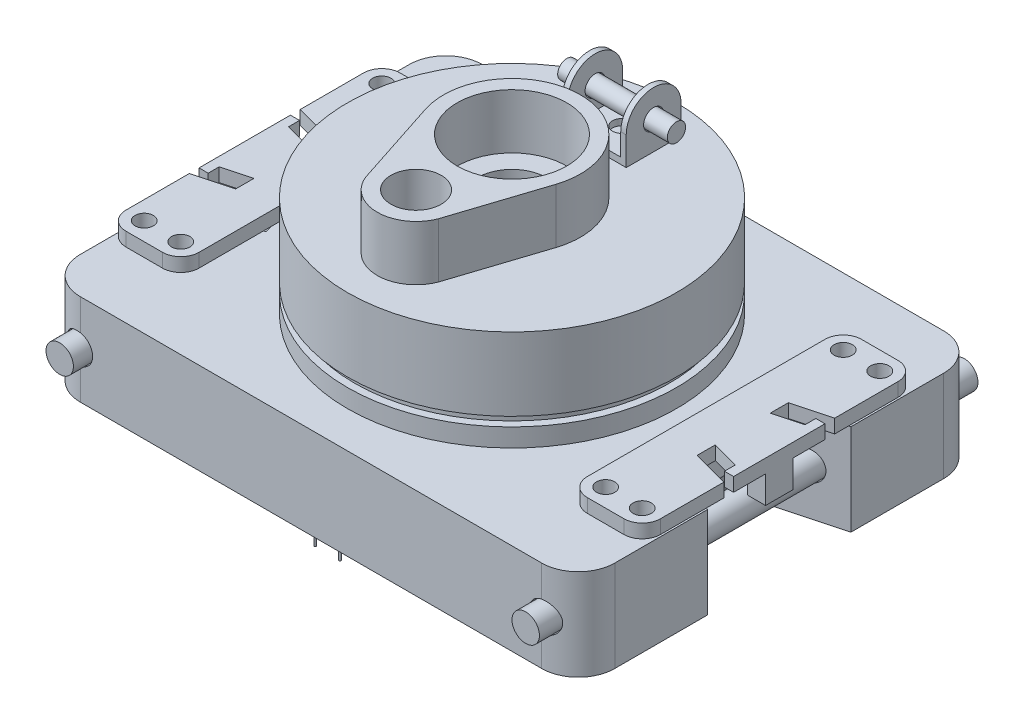
from build123d import *

# Parameters (mm, degrees)
CROQUIS1_R                     = 90
SALIENTE_EXTRUIR1_DEPTH        = 50
CROQUIS2_R                     = 30
CROQUIS2_R_2                   = 13.75
SALIENTE_EXTRUIR2_DEPTH        = 30
VACIADO1_START                 = -50
VACIADO1_OUTLINE_R             = 80
VACIADO1_DEPTH                 = 40
CORTAR_EXTRUIR1_REACH          = 138.748
CROQUIS2_3_R                   = 19
CROQUIS2_3_R_2                 = 9
CROQUIS4_R                     = 23
CROQUIS4_R_2                   = 19
SALIENTE_EXTRUIR3_DEPTH        = 95
SALIENTE_EXTRUIR4_DEPTH        = 50
CORTAR_EXTRUIR2_START          = -10
CROQUIS6_R                     = 90
CROQUIS6_R_2                   = 85
CORTAR_EXTRUIR2_DEPTH          = 10
SALIENTE_EXTRUIR6_START        = 10
CROQUIS5_3_R                   = 90
SALIENTE_EXTRUIR6_DEPTH        = 10
CORTAR_EXTRUIR4_DEPTH          = 10
CORTAR_EXTRUIR4_DEPTH_BACK     = 20
CROQUIS5_4_R                   = 86
CORTAR_EXTRUIR6_DEPTH          = 211.984835863
CORTAR_EXTRUIR6_DEPTH_BACK     = 211.984835863
CROQUIS7_R                     = 8
CROQUIS7_R_2                   = 7.5
SALIENTE_EXTRUIR7_DEPTH        = 120
SALIENTE_EXTRUIR7_DEPTH_BACK   = 120
CROQUIS7_6_R                   = 7.5
SALIENTE_EXTRUIR7_2_DEPTH      = 120
SALIENTE_EXTRUIR7_2_DEPTH_BACK = 120
CROQUIS10_R                    = 40
CROQUIS10_R_2                  = 25
SALIENTE_EXTRUIR8_DEPTH        = 15
CROQUIS11_R                    = 2.5
CROQUIS11_R_2                  = 23.75
SALIENTE_EXTRUIR9_DEPTH        = 5
CROQUIS11_R_3                  = 5
SALIENTE_EXTRUIR9_2_DEPTH      = 5
CROQUIS12_R                    = 25
CORTAR_EXTRUIR7_DEPTH          = 217.366820454
CROQUIS13_R                    = 35
CORTAR_EXTRUIR8_DEPTH          = 10
CROQUIS14_R                    = 5
SALIENTE_EXTRUIR10_DEPTH       = 7.5
SALIENTE_EXTRUIR10_2_DEPTH     = 7.5
CROQUIS15_W                    = 35
CROQUIS15_H                    = 30
CROQUIS15_R                    = 5
SALIENTE_EXTRUIR11_DEPTH       = 35
CORTAR_EXTRUIR9_START          = -30
CROQUIS16_W                    = 29
CROQUIS16_H                    = 31
CORTAR_EXTRUIR9_DEPTH          = 30
SALIENTE_EXTRUIR12_DEPTH       = 30
SALIENTE_EXTRUIR12_DEPTH_BACK  = 30
CROQUIS17_R                    = 5
CORTAR_EXTRUIR13_DEPTH         = 217.366820503
CORTAR_EXTRUIR13_DEPTH_BACK    = 217.366820503
CROQUIS17_4_R                  = 5.5
CROQUIS17_4_R_2                = 5
CROQUIS17_4_W                  = 30
CROQUIS17_4_H                  = 0.5
CROQUIS4_3_R                   = 35
CROQUIS4_3_R_2                 = 2.5
CROQUIS4_3_R_3                 = 23
SALIENTE_EXTRUIR13_DEPTH       = 7.5
CROQUIS18_R                    = 0.5
SALIENTE_EXTRUIR15_DEPTH       = 13
CROQUIS18_5_R                  = 25
SALIENTE_EXTRUIR16_DEPTH       = 5
CROQUIS19_W                    = 240
CROQUIS19_H                    = 240
CORTAR_EXTRUIR10_DEPTH         = 1
CHAFL_N1_SIZE                  = 10
CHAFL_N1_SIZE2                 = 25
CHAFL_N2_SIZE                  = 25
CHAFL_N2_SIZE2                 = 10
CROQUIS20_R                    = 35
CORTAR_EXTRUIR12_DEPTH         = 1
CROQUIS21_W                    = 10
CROQUIS21_H                    = 15
SALIENTE_EXTRUIR17_DEPTH       = 15


with BuildPart() as part:
    # Croquis1 → Saliente-Extruir1 (new body)
    with BuildSketch(Plane(origin=(0, 0, 0), x_dir=(1, 0, 0), z_dir=(0, 1, 0))):
        with Locations(Location((0, 0, 0), (0, 0, 270))):
            Circle(CROQUIS1_R)
    extrude(amount=-SALIENTE_EXTRUIR1_DEPTH)

    # Croquis2 → Saliente-Extruir2 (add)
    with BuildSketch(Plane(origin=(0, 0, 0), x_dir=(1, 0, 0), z_dir=(0, 1, 0))):
        with BuildLine():
            Line((19.816696997, -60.172093596), (35.651210757, -11.629323779))
            ThreePointArc((35.651210757, -11.629323779), (0, 37.5), (-35.651210757, -11.629323779))
            Line((-35.651210757, -11.629323779), (-19.816696997, -60.172093596))
            ThreePointArc((-19.816696997, -60.172093596), (0, -73.75), (19.816696997, -60.172093596))
        make_face()
        with Locations(Location((0, 0, 0), (0, 0, 270))):
            Circle(CROQUIS2_R, mode=Mode.SUBTRACT)
        with Locations(Location((0, -52.5, 0), (0, 0, 270))):
            Circle(CROQUIS2_R_2, mode=Mode.SUBTRACT)
    extrude(amount=SALIENTE_EXTRUIR2_DEPTH)

    # Vaciado1: read off the stored shape, not the designer's step
    # Vaciado1 outline → Vaciado1 (cut)
    with BuildSketch(Plane(origin=(0, 0, 0), x_dir=(1, 0, 0), z_dir=(0, 1, 0)).offset(VACIADO1_START)):
        Circle(VACIADO1_OUTLINE_R)
    extrude(amount=VACIADO1_DEPTH, mode=Mode.SUBTRACT)

    # Croquis2<3> → Cortar-Extruir1 (cut, up to next)
    with BuildSketch(Plane(origin=(0, 0, 0), x_dir=(1, 0, 0), z_dir=(0, 1, 0)), mode=Mode.PRIVATE) as cortar_extruir1_sk1:
        with Locations(Location((0, 0, 0), (0, 0, 270))):
            Circle(CROQUIS2_3_R)
    cortar_extruir1_tool1 = extrude(cortar_extruir1_sk1.sketch, amount=-CORTAR_EXTRUIR1_REACH, mode=Mode.PRIVATE) & part.part
    # Croquis2<3> → Cortar-Extruir1 (cut, up to next)
    with BuildSketch(Plane(origin=(0, 0, 0), x_dir=(1, 0, 0), z_dir=(0, 1, 0)), mode=Mode.PRIVATE) as cortar_extruir1_sk2:
        with Locations(Location((0, -52.5, 0), (0, 0, 270))):
            Circle(CROQUIS2_3_R_2)
    cortar_extruir1_tool2 = extrude(cortar_extruir1_sk2.sketch, amount=-CORTAR_EXTRUIR1_REACH, mode=Mode.PRIVATE) & part.part
    add(cortar_extruir1_tool1.solids().sort_by_distance((0, 0, 0))[0], mode=Mode.SUBTRACT)
    add(cortar_extruir1_tool2.solids().sort_by_distance((0, 0, 52.5))[0], mode=Mode.SUBTRACT)

    # Croquis4 → Saliente-Extruir3 (add)
    with BuildSketch(Plane.XZ.offset(10)):
        with Locations(Location((0, 0, 0), (0, 0, 90))):
            Circle(CROQUIS4_R)
        with Locations(Location((0, 0, 0), (0, 0, 90))):
            Circle(CROQUIS4_R_2, mode=Mode.SUBTRACT)
    extrude(amount=SALIENTE_EXTRUIR3_DEPTH)

    # Croquis6 → Cortar-Extruir2 (cut)
    with BuildSketch(Plane.XZ.offset(50).offset(CORTAR_EXTRUIR2_START)):
        with Locations(Location((0, 0, 0), (0, 0, 90))):
            Circle(CROQUIS6_R)
        with Locations(Location((0, 0, 0), (0, 0, 270))):
            Circle(CROQUIS6_R_2, mode=Mode.SUBTRACT)
    extrude(amount=CORTAR_EXTRUIR2_DEPTH, mode=Mode.SUBTRACT)

    # Croquis15 → Saliente-Extruir11 (add)
    with BuildSketch(Plane(origin=(0, 0, 0), x_dir=(1, 0, 0), z_dir=(0, 1, 0))):
        with Locations((0, 60)):
            Rectangle(CROQUIS15_W, CROQUIS15_H)
        with Locations(Location((0, 60, 0), (0, 0, 270))):
            Circle(CROQUIS15_R, mode=Mode.SUBTRACT)
    extrude(amount=SALIENTE_EXTRUIR11_DEPTH)

    # Croquis16 → Cortar-Extruir9 (cut)
    with BuildSketch(Plane(origin=(0, 0, -75), x_dir=(-1, 0, 0), z_dir=(0, 0, -1)).offset(CORTAR_EXTRUIR9_START)):
        with Locations((0, 19.5)):
            Rectangle(CROQUIS16_W, CROQUIS16_H)
    extrude(amount=CORTAR_EXTRUIR9_DEPTH, mode=Mode.SUBTRACT)

    # Croquis17 → Saliente-Extruir12 (add, two sides: drawn at the far end of the back side and taken through both)
    with BuildSketch(Plane(origin=(0, 0, 0), x_dir=(0, 0, -1), z_dir=(1, 0, 0)).offset(-SALIENTE_EXTRUIR12_DEPTH_BACK)):
        with Locations(Location((60, 16, 0), (0, 0, 90))):
            Circle(CROQUIS17_R)
    extrude(amount=SALIENTE_EXTRUIR12_DEPTH + SALIENTE_EXTRUIR12_DEPTH_BACK)

    # Croquis17<4> → Cortar-Extruir13 (cut, two sides: drawn at the far end of the back side and taken through both)
    # profile 1 of 3: a face of its own
    with BuildSketch(Plane(origin=(0, 0, 0), x_dir=(0, 0, -1), z_dir=(1, 0, 0)).offset(-CORTAR_EXTRUIR13_DEPTH_BACK)):
        with Locations((60, 16)):
            Circle(CROQUIS17_4_R)
        with Locations((60, 16)):
            Circle(CROQUIS17_4_R_2, mode=Mode.SUBTRACT)
    # profile 2 of 3: a face of its own
    with BuildSketch(Plane(origin=(0, 0, 0), x_dir=(0, 0, -1), z_dir=(1, 0, 0)).offset(-CORTAR_EXTRUIR13_DEPTH_BACK)):
        with BuildLine():
            Line((45, 36), (75, 36))
            Line((75, 36), (75, 16))
            ThreePointArc((75, 16), (60, 31), (45, 16))
            Line((45, 16), (45, 36))
        make_face()
    # profile 3 of 3: a face of its own
    with BuildSketch(Plane(origin=(0, 0, 0), x_dir=(0, 0, -1), z_dir=(1, 0, 0)).offset(-CORTAR_EXTRUIR13_DEPTH_BACK)):
        with Locations((60, 0.25)):
            Rectangle(CROQUIS17_4_W, CROQUIS17_4_H)
    extrude(amount=CORTAR_EXTRUIR13_DEPTH + CORTAR_EXTRUIR13_DEPTH_BACK, mode=Mode.SUBTRACT)


with BuildPart() as body_2:
    # Croquis5 → Saliente-Extruir4 (new body)
    with BuildSketch(Plane(origin=(0, -55, 0), x_dir=(1, 0, 0), z_dir=(0, 1, 0))):
        with BuildLine():
            Line((106.251840892, 28.470094961), (146.251840892, 39.188062659))
            Line((146.251840892, 39.188062659), (146.251840892, 90))
            ThreePointArc((146.251840892, 90), (140.393976516, 104.142135624), (126.251840892, 110))
            Line((126.251840892, 110), (-126.251840892, 110))
            ThreePointArc((-126.251840892, 110), (-140.393976516, 104.142135624), (-146.251840892, 90))
            Line((-146.251840892, 90), (-146.251840892, 39.188062659))
            Line((-146.251840892, 39.188062659), (-106.251840892, 28.470094961))
            ThreePointArc((-106.251840892, 28.470094961), (-110, 0), (-106.251840892, -28.470094961))
            Line((-106.251840892, -28.470094961), (-146.251840892, -39.188062659))
            Line((-146.251840892, -39.188062659), (-146.251840892, -90))
            ThreePointArc((-146.251840892, -90), (-140.393976516, -104.142135624), (-126.251840892, -110))
            Line((-126.251840892, -110), (126.251840892, -110))
            ThreePointArc((126.251840892, -110), (140.393976516, -104.142135624), (146.251840892, -90))
            Line((146.251840892, -90), (146.251840892, -39.188062659))
            Line((146.251840892, -39.188062659), (106.251840892, -28.470094961))
            ThreePointArc((106.251840892, -28.470094961), (110, 0), (106.251840892, 28.470094961))
        make_face()
    extrude(amount=-SALIENTE_EXTRUIR4_DEPTH)

    # Croquis5<3> → Saliente-Extruir6 (add)
    with BuildSketch(Plane(origin=(0, -55, 0), x_dir=(1, 0, 0), z_dir=(0, 1, 0)).offset(SALIENTE_EXTRUIR6_START)):
        with Locations(Location((0, 0, 0), (0, 0, 270))):
            Circle(CROQUIS5_3_R)
    extrude(amount=-SALIENTE_EXTRUIR6_DEPTH)

    # Croquis5<4> → Cortar-Extruir4 (cut, two sides: drawn at the far end of the back side and taken through both)
    with BuildSketch(Plane(origin=(0, -55, 0), x_dir=(1, 0, 0), z_dir=(0, 1, 0)).offset(-CORTAR_EXTRUIR4_DEPTH_BACK)):
        with Locations(Location((0, 0, 0), (0, 0, 270))):
            Circle(CROQUIS5_4_R)
    extrude(amount=CORTAR_EXTRUIR4_DEPTH + CORTAR_EXTRUIR4_DEPTH_BACK, mode=Mode.SUBTRACT)

    # Croquis7 → Cortar-Extruir6 (cut, two sides: drawn at the far end of the back side and taken through both)
    # profile 1 of 2: a face of its own
    with BuildSketch(Plane.XY.offset(-CORTAR_EXTRUIR6_DEPTH_BACK)):
        with Locations((127.5, -80)):
            Circle(CROQUIS7_R)
        with Locations((127.5, -80)):
            Circle(CROQUIS7_R_2, mode=Mode.SUBTRACT)
    # profile 2 of 2: a face of its own
    with BuildSketch(Plane.XY.offset(-CORTAR_EXTRUIR6_DEPTH_BACK)):
        with Locations(Location((-127.5, -80, 0), (0, 0, 81.024048776))):
            Circle(CROQUIS7_R)
        with Locations((-127.5, -80)):
            Circle(CROQUIS7_R_2, mode=Mode.SUBTRACT)
    extrude(amount=CORTAR_EXTRUIR6_DEPTH + CORTAR_EXTRUIR6_DEPTH_BACK, mode=Mode.SUBTRACT)


with BuildPart() as cortar_extruir6_kept_piece:
    # of the separate pieces the step leaves, the one the design keeps (cortar_extruir6_pieces_kept)
    add(body_2.part.solids().sort_by_distance((106.251840892, -55, -28.470094961))[0])

    # Croquis10 → Saliente-Extruir8 (add)
    with BuildSketch(Plane(origin=(0, -75, 0), x_dir=(1, 0, 0), z_dir=(0, 1, 0))):
        with Locations(Location((0, 0, 0), (0, 0, 270))):
            Circle(CROQUIS10_R)
        with Locations(Location((0, 0, 0), (0, 0, 270))):
            Circle(CROQUIS10_R_2, mode=Mode.SUBTRACT)
    extrude(amount=SALIENTE_EXTRUIR8_DEPTH)

    # Croquis12 → Cortar-Extruir7 (cut, through all)
    with BuildSketch(Plane(origin=(0, -75, 0), x_dir=(1, 0, 0), z_dir=(0, 1, 0))):
        with Locations(Location((0, 0, 0), (0, 0, 270))):
            Circle(CROQUIS12_R)
    extrude(amount=-CORTAR_EXTRUIR7_DEPTH, mode=Mode.SUBTRACT)

    # Croquis13 → Cortar-Extruir8 (cut)
    with BuildSketch(Plane.XZ.offset(105)):
        with Locations(Location((0, 0, 0), (0, 0, 270))):
            Circle(CROQUIS13_R)
    extrude(amount=-CORTAR_EXTRUIR8_DEPTH, mode=Mode.SUBTRACT)

    # Croquis18 → Saliente-Extruir15 (add)
    with BuildSketch(Plane.XZ.offset(105)):
        with Locations(Location((-77.166430053, -6.465637775, 0), (0, 0, 270))):
            Circle(CROQUIS18_R)
        with Locations(Location((-81.616023522, -9.698456663, 0), (0, 0, 270))):
            Circle(CROQUIS18_R)
        with Locations(Location((-86.065616991, -12.93127555, 0), (0, 0, 270))):
            Circle(CROQUIS18_R)
        with Locations(Location((-63.817649646, 3.232818888, 0), (0, 0, 270))):
            Circle(CROQUIS18_R)
        with Locations(Location((-59.368056177, 6.465637775, 0), (0, 0, 270))):
            Circle(CROQUIS18_R)
        with Locations(Location((-54.918462708, 9.698456663, 0), (0, 0, 270))):
            Circle(CROQUIS18_R)
        with Locations(Location((-50.468869239, 12.93127555, 0), (0, 0, 270))):
            Circle(CROQUIS18_R)
        with Locations(Location((-66.567649646, 5.23081084, 0), (0, 0, 270))):
            Circle(CROQUIS18_R)
        with Locations(Location((-64.868056177, 10.461621679, 0), (0, 0, 270))):
            Circle(CROQUIS18_R)
        with Locations(Location((-63.168462708, 15.692432519, 0), (0, 0, 270))):
            Circle(CROQUIS18_R)
        with Locations(Location((-61.468869239, 20.923243358, 0), (0, 0, 270))):
            Circle(CROQUIS18_R)
        with Locations(Location((-75.065616991, 20.923243358, 0), (0, 0, 270))):
            Circle(CROQUIS18_R)
        with Locations(Location((-73.366023522, 15.692432519, 0), (0, 0, 270))):
            Circle(CROQUIS18_R)
        with Locations(Location((-71.666430053, 10.461621679, 0), (0, 0, 270))):
            Circle(CROQUIS18_R)
        with Locations(Location((-69.966836584, 5.23081084, 0), (0, 0, 270))):
            Circle(CROQUIS18_R)
        with Locations(Location((-72.716836584, 3.232818888, 0), (0, 0, 270))):
            Circle(CROQUIS18_R)
        with Locations(Location((22, 80, 0), (0, 0, 270))):
            Circle(CROQUIS18_R)
        with Locations(Location((16.5, 80, 0), (0, 0, 270))):
            Circle(CROQUIS18_R)
        with Locations(Location((5.5, 80, 0), (0, 0, 270))):
            Circle(CROQUIS18_R)
        with Locations(Location((11, 80, 0), (0, 0, 270))):
            Circle(CROQUIS18_R)
        with Locations(Location((17.798373876, 67.06872445, 0), (0, 0, 270))):
            Circle(CROQUIS18_R)
        with Locations(Location((13.348780407, 70.301543337, 0), (0, 0, 270))):
            Circle(CROQUIS18_R)
        with Locations(Location((8.899186938, 73.534362225, 0), (0, 0, 270))):
            Circle(CROQUIS18_R)
        with Locations(Location((4.449593469, 76.767181112, 0), (0, 0, 270))):
            Circle(CROQUIS18_R)
        with Locations(Location((0, 80, 0), (0, 0, 270))):
            Circle(CROQUIS18_R)
        with Locations(Location((4.449593469, 83.232818888, 0), (0, 0, 270))):
            Circle(CROQUIS18_R)
        with Locations(Location((8.899186938, 86.465637775, 0), (0, 0, 270))):
            Circle(CROQUIS18_R)
        with Locations(Location((13.348780407, 89.698456663, 0), (0, 0, 270))):
            Circle(CROQUIS18_R)
        with Locations(Location((17.798373876, 92.93127555, 0), (0, 0, 270))):
            Circle(CROQUIS18_R)
        with Locations(Location((3.399186938, 90.461621679, 0), (0, 0, 270))):
            Circle(CROQUIS18_R)
        with Locations(Location((5.098780407, 95.692432519, 0), (0, 0, 270))):
            Circle(CROQUIS18_R)
        with Locations(Location((6.798373876, 100.923243358, 0), (0, 0, 270))):
            Circle(CROQUIS18_R)
        with Locations(Location((-6.798373876, 100.923243358, 0), (0, 0, 270))):
            Circle(CROQUIS18_R)
        with Locations(Location((-5.098780407, 95.692432519, 0), (0, 0, 270))):
            Circle(CROQUIS18_R)
        with Locations(Location((-3.399186938, 90.461621679, 0), (0, 0, 270))):
            Circle(CROQUIS18_R)
        with Locations(Location((1.699593469, 85.23081084, 0), (0, 0, 270))):
            Circle(CROQUIS18_R)
        with Locations(Location((-1.699593469, 85.23081084, 0), (0, 0, 270))):
            Circle(CROQUIS18_R)
        with Locations(Location((-4.449593469, 83.232818888, 0), (0, 0, 270))):
            Circle(CROQUIS18_R)
        with Locations(Location((-8.899186938, 86.465637775, 0), (0, 0, 270))):
            Circle(CROQUIS18_R)
        with Locations(Location((-13.348780407, 89.698456663, 0), (0, 0, 270))):
            Circle(CROQUIS18_R)
        with Locations(Location((-17.798373876, 92.93127555, 0), (0, 0, 270))):
            Circle(CROQUIS18_R)
        with Locations(Location((-22, 80, 0), (0, 0, 270))):
            Circle(CROQUIS18_R)
        with Locations(Location((-16.5, 80, 0), (0, 0, 270))):
            Circle(CROQUIS18_R)
        with Locations(Location((-17.798373876, 67.06872445, 0), (0, 0, 270))):
            Circle(CROQUIS18_R)
        with Locations(Location((-13.348780407, 70.301543337, 0), (0, 0, 270))):
            Circle(CROQUIS18_R)
        with Locations(Location((-11, 80, 0), (0, 0, 270))):
            Circle(CROQUIS18_R)
        with Locations(Location((-8.899186938, 73.534362225, 0), (0, 0, 270))):
            Circle(CROQUIS18_R)
        with Locations(Location((-4.449593469, 76.767181112, 0), (0, 0, 270))):
            Circle(CROQUIS18_R)
        with Locations(Location((-5.5, 80, 0), (0, 0, 270))):
            Circle(CROQUIS18_R)
        with Locations(Location((-3.399186938, 69.538378321, 0), (0, 0, 270))):
            Circle(CROQUIS18_R)
        with Locations(Location((-5.098780407, 64.307567481, 0), (0, 0, 270))):
            Circle(CROQUIS18_R)
        with Locations(Location((-6.798373876, 59.076756642, 0), (0, 0, 270))):
            Circle(CROQUIS18_R)
        with Locations(Location((6.798373876, 59.076756642, 0), (0, 0, 270))):
            Circle(CROQUIS18_R)
        with Locations(Location((5.098780407, 64.307567481, 0), (0, 0, 270))):
            Circle(CROQUIS18_R)
        with Locations(Location((3.399186938, 69.538378321, 0), (0, 0, 270))):
            Circle(CROQUIS18_R)
        with Locations(Location((1.699593469, 74.76918916, 0), (0, 0, 270))):
            Circle(CROQUIS18_R)
        with Locations(Location((-1.699593469, 74.76918916, 0), (0, 0, 270))):
            Circle(CROQUIS18_R)
        with Locations(Location((75.065616991, -20.923243358, 0), (0, 0, 270))):
            Circle(CROQUIS18_R)
        with Locations(Location((73.366023522, -15.692432519, 0), (0, 0, 270))):
            Circle(CROQUIS18_R)
        with Locations(Location((71.666430053, -10.461621679, 0), (0, 0, 270))):
            Circle(CROQUIS18_R)
        with Locations(Location((69.966836584, -5.23081084, 0), (0, 0, 270))):
            Circle(CROQUIS18_R)
        with Locations(Location((68.267243115, 0, 0), (0, 0, 270))):
            Circle(CROQUIS18_R)
        with Locations(Location((66.567649646, 5.23081084, 0), (0, 0, 270))):
            Circle(CROQUIS18_R)
        with Locations(Location((64.868056177, 10.461621679, 0), (0, 0, 270))):
            Circle(CROQUIS18_R)
        with Locations(Location((63.168462708, 15.692432519, 0), (0, 0, 270))):
            Circle(CROQUIS18_R)
        with Locations(Location((61.468869239, 20.923243358, 0), (0, 0, 270))):
            Circle(CROQUIS18_R)
        with Locations(Location((75.065616991, 20.923243358, 0), (0, 0, 270))):
            Circle(CROQUIS18_R)
        with Locations(Location((73.366023522, 15.692432519, 0), (0, 0, 270))):
            Circle(CROQUIS18_R)
        with Locations(Location((71.666430053, 10.461621679, 0), (0, 0, 270))):
            Circle(CROQUIS18_R)
        with Locations(Location((69.966836584, 5.23081084, 0), (0, 0, 270))):
            Circle(CROQUIS18_R)
        with Locations(Location((66.567649646, -5.23081084, 0), (0, 0, 270))):
            Circle(CROQUIS18_R)
        with Locations(Location((64.868056177, -10.461621679, 0), (0, 0, 270))):
            Circle(CROQUIS18_R)
        with Locations(Location((63.168462708, -15.692432519, 0), (0, 0, 270))):
            Circle(CROQUIS18_R)
        with Locations(Location((61.468869239, -20.923243358, 0), (0, 0, 270))):
            Circle(CROQUIS18_R)
        with Locations(Location((50.468869239, 12.93127555, 0), (0, 0, 270))):
            Circle(CROQUIS18_R)
        with Locations(Location((54.918462708, 9.698456663, 0), (0, 0, 270))):
            Circle(CROQUIS18_R)
        with Locations(Location((59.368056177, 6.465637775, 0), (0, 0, 270))):
            Circle(CROQUIS18_R)
        with Locations(Location((63.817649646, 3.232818888, 0), (0, 0, 270))):
            Circle(CROQUIS18_R)
        with Locations(Location((72.716836584, -3.232818888, 0), (0, 0, 270))):
            Circle(CROQUIS18_R)
        with Locations(Location((77.166430053, -6.465637775, 0), (0, 0, 270))):
            Circle(CROQUIS18_R)
        with Locations(Location((81.616023522, -9.698456663, 0), (0, 0, 270))):
            Circle(CROQUIS18_R)
        with Locations(Location((86.065616991, -12.93127555, 0), (0, 0, 270))):
            Circle(CROQUIS18_R)
        with Locations(Location((50.468869239, -12.93127555, 0), (0, 0, 270))):
            Circle(CROQUIS18_R)
        with Locations(Location((54.918462708, -9.698456663, 0), (0, 0, 270))):
            Circle(CROQUIS18_R)
        with Locations(Location((59.368056177, -6.465637775, 0), (0, 0, 270))):
            Circle(CROQUIS18_R)
        with Locations(Location((63.817649646, -3.232818888, 0), (0, 0, 270))):
            Circle(CROQUIS18_R)
        with Locations(Location((72.716836584, 3.232818888, 0), (0, 0, 270))):
            Circle(CROQUIS18_R)
        with Locations(Location((77.166430053, 6.465637775, 0), (0, 0, 270))):
            Circle(CROQUIS18_R)
        with Locations(Location((81.616023522, 9.698456663, 0), (0, 0, 270))):
            Circle(CROQUIS18_R)
        with Locations(Location((86.065616991, 12.93127555, 0), (0, 0, 270))):
            Circle(CROQUIS18_R)
        with Locations(Location((90.267243115, 0, 0), (0, 0, 270))):
            Circle(CROQUIS18_R)
        with Locations(Location((84.767243115, 0, 0), (0, 0, 270))):
            Circle(CROQUIS18_R)
        with Locations(Location((79.267243115, 0, 0), (0, 0, 270))):
            Circle(CROQUIS18_R)
        with Locations(Location((73.767243115, 0, 0), (0, 0, 270))):
            Circle(CROQUIS18_R)
        with Locations(Location((62.767243115, 0, 0), (0, 0, 270))):
            Circle(CROQUIS18_R)
        with Locations(Location((57.267243115, 0, 0), (0, 0, 270))):
            Circle(CROQUIS18_R)
        with Locations(Location((51.767243115, 0, 0), (0, 0, 270))):
            Circle(CROQUIS18_R)
        with Locations(Location((46.267243115, 0, 0), (0, 0, 270))):
            Circle(CROQUIS18_R)
        with Locations(Location((-46.267243115, 0, 0), (0, 0, 90))):
            Circle(CROQUIS18_R)
        with Locations(Location((-51.767243115, 0, 0), (0, 0, 90))):
            Circle(CROQUIS18_R)
        with Locations(Location((-57.267243115, 0, 0), (0, 0, 90))):
            Circle(CROQUIS18_R)
        with Locations(Location((-62.767243115, 0, 0), (0, 0, 90))):
            Circle(CROQUIS18_R)
        with Locations(Location((-68.267243115, 0, 0), (0, 0, 90))):
            Circle(CROQUIS18_R)
        with Locations(Location((-73.767243115, 0, 0), (0, 0, 90))):
            Circle(CROQUIS18_R)
        with Locations(Location((-79.267243115, 0, 0), (0, 0, 90))):
            Circle(CROQUIS18_R)
        with Locations(Location((-84.767243115, 0, 0), (0, 0, 90))):
            Circle(CROQUIS18_R)
        with Locations(Location((-90.267243115, 0, 0), (0, 0, 90))):
            Circle(CROQUIS18_R)
        with Locations(Location((-72.716836584, -3.232818888, 0), (0, 0, 90))):
            Circle(CROQUIS18_R)
        with Locations(Location((-77.166430053, 6.465637775, 0), (0, 0, 90))):
            Circle(CROQUIS18_R)
        with Locations(Location((-81.616023522, 9.698456663, 0), (0, 0, 90))):
            Circle(CROQUIS18_R)
        with Locations(Location((-86.065616991, 12.93127555, 0), (0, 0, 90))):
            Circle(CROQUIS18_R)
        with Locations(Location((-69.966836584, -5.23081084, 0), (0, 0, 90))):
            Circle(CROQUIS18_R)
        with Locations(Location((-66.567649646, -5.23081084, 0), (0, 0, 90))):
            Circle(CROQUIS18_R)
        with Locations(Location((-63.817649646, -3.232818888, 0), (0, 0, 90))):
            Circle(CROQUIS18_R)
        with Locations(Location((-61.468869239, -20.923243358, 0), (0, 0, 90))):
            Circle(CROQUIS18_R)
        with Locations(Location((-63.168462708, -15.692432519, 0), (0, 0, 90))):
            Circle(CROQUIS18_R)
        with Locations(Location((-64.868056177, -10.461621679, 0), (0, 0, 90))):
            Circle(CROQUIS18_R)
        with Locations(Location((-71.666430053, -10.461621679, 0), (0, 0, 90))):
            Circle(CROQUIS18_R)
        with Locations(Location((-73.366023522, -15.692432519, 0), (0, 0, 90))):
            Circle(CROQUIS18_R)
        with Locations(Location((-75.065616991, -20.923243358, 0), (0, 0, 90))):
            Circle(CROQUIS18_R)
        with Locations(Location((-50.468869239, -12.93127555, 0), (0, 0, 90))):
            Circle(CROQUIS18_R)
        with Locations(Location((-54.918462708, -9.698456663, 0), (0, 0, 90))):
            Circle(CROQUIS18_R)
        with Locations(Location((-59.368056177, -6.465637775, 0), (0, 0, 90))):
            Circle(CROQUIS18_R)
        with Locations(Location((22, -80, 0), (0, 0, 90))):
            Circle(CROQUIS18_R)
        with Locations(Location((16.5, -80, 0), (0, 0, 90))):
            Circle(CROQUIS18_R)
        with Locations(Location((11, -80, 0), (0, 0, 90))):
            Circle(CROQUIS18_R)
        with Locations(Location((5.5, -80, 0), (0, 0, 90))):
            Circle(CROQUIS18_R)
        with Locations(Location((0, -80, 0), (0, 0, 90))):
            Circle(CROQUIS18_R)
        with Locations(Location((-5.5, -80, 0), (0, 0, 90))):
            Circle(CROQUIS18_R)
        with Locations(Location((-11, -80, 0), (0, 0, 90))):
            Circle(CROQUIS18_R)
        with Locations(Location((-16.5, -80, 0), (0, 0, 90))):
            Circle(CROQUIS18_R)
        with Locations(Location((-22, -80, 0), (0, 0, 90))):
            Circle(CROQUIS18_R)
        with Locations(Location((4.449593469, -76.767181112, 0), (0, 0, 90))):
            Circle(CROQUIS18_R)
        with Locations(Location((1.699593469, -74.76918916, 0), (0, 0, 90))):
            Circle(CROQUIS18_R)
        with Locations(Location((-1.699593469, -74.76918916, 0), (0, 0, 90))):
            Circle(CROQUIS18_R)
        with Locations(Location((-4.449593469, -76.767181112, 0), (0, 0, 90))):
            Circle(CROQUIS18_R)
        with Locations(Location((-4.449593469, -83.232818888, 0), (0, 0, 90))):
            Circle(CROQUIS18_R)
        with Locations(Location((-1.699593469, -85.23081084, 0), (0, 0, 90))):
            Circle(CROQUIS18_R)
        with Locations(Location((1.699593469, -85.23081084, 0), (0, 0, 90))):
            Circle(CROQUIS18_R)
        with Locations(Location((4.449593469, -83.232818888, 0), (0, 0, 90))):
            Circle(CROQUIS18_R)
        with Locations(Location((8.899186938, -73.534362225, 0), (0, 0, 90))):
            Circle(CROQUIS18_R)
        with Locations(Location((13.348780407, -70.301543337, 0), (0, 0, 90))):
            Circle(CROQUIS18_R)
        with Locations(Location((17.798373876, -67.06872445, 0), (0, 0, 90))):
            Circle(CROQUIS18_R)
        with Locations(Location((3.399186938, -69.538378321, 0), (0, 0, 90))):
            Circle(CROQUIS18_R)
        with Locations(Location((5.098780407, -64.307567481, 0), (0, 0, 90))):
            Circle(CROQUIS18_R)
        with Locations(Location((6.798373876, -59.076756642, 0), (0, 0, 90))):
            Circle(CROQUIS18_R)
        with Locations(Location((-6.798373876, -59.076756642, 0), (0, 0, 90))):
            Circle(CROQUIS18_R)
        with Locations(Location((-5.098780407, -64.307567481, 0), (0, 0, 90))):
            Circle(CROQUIS18_R)
        with Locations(Location((-3.399186938, -69.538378321, 0), (0, 0, 90))):
            Circle(CROQUIS18_R)
        with Locations(Location((-8.899186938, -73.534362225, 0), (0, 0, 90))):
            Circle(CROQUIS18_R)
        with Locations(Location((-13.348780407, -70.301543337, 0), (0, 0, 90))):
            Circle(CROQUIS18_R)
        with Locations(Location((-17.798373876, -67.06872445, 0), (0, 0, 90))):
            Circle(CROQUIS18_R)
        with Locations(Location((8.899186938, -86.465637775, 0), (0, 0, 90))):
            Circle(CROQUIS18_R)
        with Locations(Location((13.348780407, -89.698456663, 0), (0, 0, 90))):
            Circle(CROQUIS18_R)
        with Locations(Location((17.798373876, -92.93127555, 0), (0, 0, 90))):
            Circle(CROQUIS18_R)
        with Locations(Location((5.098780407, -95.692432519, 0), (0, 0, 90))):
            Circle(CROQUIS18_R)
        with Locations(Location((6.798373876, -100.923243358, 0), (0, 0, 90))):
            Circle(CROQUIS18_R)
        with Locations(Location((3.399186938, -90.461621679, 0), (0, 0, 90))):
            Circle(CROQUIS18_R)
        with Locations(Location((-3.399186938, -90.461621679, 0), (0, 0, 90))):
            Circle(CROQUIS18_R)
        with Locations(Location((-5.098780407, -95.692432519, 0), (0, 0, 90))):
            Circle(CROQUIS18_R)
        with Locations(Location((-6.798373876, -100.923243358, 0), (0, 0, 90))):
            Circle(CROQUIS18_R)
        with Locations(Location((-8.899186938, -86.465637775, 0), (0, 0, 90))):
            Circle(CROQUIS18_R)
        with Locations(Location((-13.348780407, -89.698456663, 0), (0, 0, 90))):
            Circle(CROQUIS18_R)
        with Locations(Location((-17.798373876, -92.93127555, 0), (0, 0, 90))):
            Circle(CROQUIS18_R)
    extrude(amount=SALIENTE_EXTRUIR15_DEPTH)

    # Croquis18<5> → Saliente-Extruir16 (add)
    with BuildSketch(Plane.XZ.offset(105)):
        with Locations(Location((0, 80, 0), (0, 0, 270))):
            Circle(CROQUIS18_5_R)
        with Locations(Location((68.267243115, 0, 0), (0, 0, 270))):
            Circle(CROQUIS18_5_R)
        with Locations(Location((-68.267243115, 0, 0), (0, 0, 90))):
            Circle(CROQUIS18_5_R)
        with Locations(Location((0, -80, 0), (0, 0, 90))):
            Circle(CROQUIS18_5_R)
    extrude(amount=SALIENTE_EXTRUIR16_DEPTH)

    # Croquis19 → Cortar-Extruir10 (cut)
    with BuildSketch(Plane(origin=(0, -106, 0), x_dir=(-1, 0, 0), z_dir=(0, -1, 0))):
        Rectangle(CROQUIS19_W, CROQUIS19_H)
    extrude(amount=-CORTAR_EXTRUIR10_DEPTH, mode=Mode.SUBTRACT)


with BuildPart() as body_3:
    # Croquis7<6> → Saliente-Extruir7 (new, two sides: drawn at the far end of the back side and taken through both)
    with BuildSketch(Plane.XY.offset(-SALIENTE_EXTRUIR7_DEPTH_BACK)):
        with Locations((127.5, -80)):
            Circle(CROQUIS7_6_R)
    extrude(amount=SALIENTE_EXTRUIR7_DEPTH + SALIENTE_EXTRUIR7_DEPTH_BACK)


with BuildPart() as body_4:
    # Croquis7<6> → Saliente-Extruir7 2 (new, two sides: drawn at the far end of the back side and taken through both)
    with BuildSketch(Plane.XY.offset(-SALIENTE_EXTRUIR7_2_DEPTH_BACK)):
        with Locations(Location((-127.5, -80, 0), (0, 0, 180))):
            Circle(CROQUIS7_6_R)
    extrude(amount=SALIENTE_EXTRUIR7_2_DEPTH + SALIENTE_EXTRUIR7_2_DEPTH_BACK)


with BuildPart() as body_5:
    # Croquis11 → Saliente-Extruir9 (new body)
    with BuildSketch(Plane(origin=(0, -59, 0), x_dir=(1, 0, 0), z_dir=(0, 1, 0))):
        with BuildLine():
            Line((-3.75, 39.823830805), (-2.5, 44.429719783))
            ThreePointArc((-2.5, 44.429719783), (0, 44.5), (2.5, 44.429719783))
            Line((2.5, 44.429719783), (3.75, 39.823830805))
            ThreePointArc((3.75, 39.823830805), (5.221047689, 39.657794455), (6.684944013, 39.437438096))
            Line((6.684944013, 39.437438096), (9.084443083, 43.562861406))
            ThreePointArc((9.084443083, 43.562861406), (11.517447507, 42.98369927), (13.914072214, 42.26876618))
            Line((13.914072214, 42.26876618), (13.92938771, 37.496295257))
            ThreePointArc((13.92938771, 37.496295257), (15.307337295, 36.9551813), (16.664320138, 36.363449153))
            Line((16.664320138, 36.363449153), (20.049796382, 39.727266015))
            ThreePointArc((20.049796382, 39.727266015), (22.25, 38.538130468), (24.379923401, 37.227266015))
            Line((24.379923401, 37.227266015), (23.159510667, 32.613449153))
            ThreePointArc((23.159510667, 32.613449153), (24.35045716, 31.734133612), (25.508050386, 30.811351245))
            Line((25.508050386, 30.811351245), (29.648789192, 33.184323098))
            ThreePointArc((29.648789192, 33.184323098), (31.466251763, 31.466251763), (33.184323098, 29.648789192))
            Line((33.184323098, 29.648789192), (30.811351245, 25.508050386))
            ThreePointArc((30.811351245, 25.508050386), (31.734133612, 24.35045716), (32.613449153, 23.159510667))
            Line((32.613449153, 23.159510667), (37.227266015, 24.379923401))
            ThreePointArc((37.227266015, 24.379923401), (38.538130468, 22.25), (39.727266015, 20.049796382))
            Line((39.727266015, 20.049796382), (36.363449153, 16.664320138))
            ThreePointArc((36.363449153, 16.664320138), (36.9551813, 15.307337295), (37.496295257, 13.92938771))
            Line((37.496295257, 13.92938771), (42.26876618, 13.914072214))
            ThreePointArc((42.26876618, 13.914072214), (42.98369927, 11.517447507), (43.562861406, 9.084443083))
            Line((43.562861406, 9.084443083), (39.437438096, 6.684944013))
            ThreePointArc((39.437438096, 6.684944013), (39.657794455, 5.221047689), (39.823830805, 3.75))
            Line((39.823830805, 3.75), (44.429719783, 2.5))
            ThreePointArc((44.429719783, 2.5), (44.5, 0), (44.429719783, -2.5))
            Line((44.429719783, -2.5), (39.823830805, -3.75))
            ThreePointArc((39.823830805, -3.75), (39.657794455, -5.221047689), (39.437438096, -6.684944013))
            Line((39.437438096, -6.684944013), (43.562861406, -9.084443083))
            ThreePointArc((43.562861406, -9.084443083), (42.98369927, -11.517447507), (42.26876618, -13.914072214))
            Line((42.26876618, -13.914072214), (37.496295257, -13.92938771))
            ThreePointArc((37.496295257, -13.92938771), (36.9551813, -15.307337295), (36.363449153, -16.664320138))
            Line((36.363449153, -16.664320138), (39.727266015, -20.049796382))
            ThreePointArc((39.727266015, -20.049796382), (38.538130468, -22.25), (37.227266015, -24.379923401))
            Line((37.227266015, -24.379923401), (32.613449153, -23.159510667))
            ThreePointArc((32.613449153, -23.159510667), (31.734133612, -24.35045716), (30.811351245, -25.508050386))
            Line((30.811351245, -25.508050386), (33.184323098, -29.648789192))
            ThreePointArc((33.184323098, -29.648789192), (31.466251763, -31.466251763), (29.648789192, -33.184323098))
            Line((29.648789192, -33.184323098), (25.508050386, -30.811351245))
            ThreePointArc((25.508050386, -30.811351245), (24.35045716, -31.734133612), (23.159510667, -32.613449153))
            Line((23.159510667, -32.613449153), (24.379923401, -37.227266015))
            ThreePointArc((24.379923401, -37.227266015), (22.25, -38.538130468), (20.049796382, -39.727266015))
            Line((20.049796382, -39.727266015), (16.664320138, -36.363449153))
            ThreePointArc((16.664320138, -36.363449153), (15.307337295, -36.9551813), (13.92938771, -37.496295257))
            Line((13.92938771, -37.496295257), (13.914072214, -42.26876618))
            ThreePointArc((13.914072214, -42.26876618), (11.517447507, -42.98369927), (9.084443083, -43.562861406))
            Line((9.084443083, -43.562861406), (6.684944013, -39.437438096))
            ThreePointArc((6.684944013, -39.437438096), (5.221047689, -39.657794455), (3.75, -39.823830805))
            Line((3.75, -39.823830805), (2.5, -44.429719783))
            ThreePointArc((2.5, -44.429719783), (0, -44.5), (-2.5, -44.429719783))
            Line((-2.5, -44.429719783), (-3.75, -39.823830805))
            ThreePointArc((-3.75, -39.823830805), (-5.221047689, -39.657794455), (-6.684944013, -39.437438096))
            Line((-6.684944013, -39.437438096), (-9.084443083, -43.562861406))
            ThreePointArc((-9.084443083, -43.562861406), (-11.517447507, -42.98369927), (-13.914072214, -42.26876618))
            Line((-13.914072214, -42.26876618), (-13.92938771, -37.496295257))
            ThreePointArc((-13.92938771, -37.496295257), (-15.307337295, -36.9551813), (-16.664320138, -36.363449153))
            Line((-16.664320138, -36.363449153), (-20.049796382, -39.727266015))
            ThreePointArc((-20.049796382, -39.727266015), (-22.25, -38.538130468), (-24.379923401, -37.227266015))
            Line((-24.379923401, -37.227266015), (-23.159510667, -32.613449153))
            ThreePointArc((-23.159510667, -32.613449153), (-24.35045716, -31.734133612), (-25.508050386, -30.811351245))
            Line((-25.508050386, -30.811351245), (-29.648789192, -33.184323098))
            ThreePointArc((-29.648789192, -33.184323098), (-31.466251763, -31.466251763), (-33.184323098, -29.648789192))
            Line((-33.184323098, -29.648789192), (-30.811351245, -25.508050386))
            ThreePointArc((-30.811351245, -25.508050386), (-31.734133612, -24.35045716), (-32.613449153, -23.159510667))
            Line((-32.613449153, -23.159510667), (-37.227266015, -24.379923401))
            ThreePointArc((-37.227266015, -24.379923401), (-38.538130468, -22.25), (-39.727266015, -20.049796382))
            Line((-39.727266015, -20.049796382), (-36.363449153, -16.664320138))
            ThreePointArc((-36.363449153, -16.664320138), (-36.9551813, -15.307337295), (-37.496295257, -13.92938771))
            Line((-37.496295257, -13.92938771), (-42.26876618, -13.914072214))
            ThreePointArc((-42.26876618, -13.914072214), (-42.98369927, -11.517447507), (-43.562861406, -9.084443083))
            Line((-43.562861406, -9.084443083), (-39.437438096, -6.684944013))
            ThreePointArc((-39.437438096, -6.684944013), (-39.657794455, -5.221047689), (-39.823830805, -3.75))
            Line((-39.823830805, -3.75), (-44.429719783, -2.5))
            ThreePointArc((-44.429719783, -2.5), (-44.5, 0), (-44.429719783, 2.5))
            Line((-44.429719783, 2.5), (-39.823830805, 3.75))
            ThreePointArc((-39.823830805, 3.75), (-39.657794455, 5.221047689), (-39.437438096, 6.684944013))
            Line((-39.437438096, 6.684944013), (-43.562861406, 9.084443083))
            ThreePointArc((-43.562861406, 9.084443083), (-42.98369927, 11.517447507), (-42.26876618, 13.914072214))
            Line((-42.26876618, 13.914072214), (-37.496295257, 13.92938771))
            ThreePointArc((-37.496295257, 13.92938771), (-36.9551813, 15.307337295), (-36.363449153, 16.664320138))
            Line((-36.363449153, 16.664320138), (-39.727266015, 20.049796382))
            ThreePointArc((-39.727266015, 20.049796382), (-38.538130468, 22.25), (-37.227266015, 24.379923401))
            Line((-37.227266015, 24.379923401), (-32.613449153, 23.159510667))
            ThreePointArc((-32.613449153, 23.159510667), (-31.734133612, 24.35045716), (-30.811351245, 25.508050386))
            Line((-30.811351245, 25.508050386), (-33.184323098, 29.648789192))
            ThreePointArc((-33.184323098, 29.648789192), (-31.466251763, 31.466251763), (-29.648789192, 33.184323098))
            Line((-29.648789192, 33.184323098), (-25.508050386, 30.811351245))
            ThreePointArc((-25.508050386, 30.811351245), (-24.35045716, 31.734133612), (-23.159510667, 32.613449153))
            Line((-23.159510667, 32.613449153), (-24.379923401, 37.227266015))
            ThreePointArc((-24.379923401, 37.227266015), (-22.25, 38.538130468), (-20.049796382, 39.727266015))
            Line((-20.049796382, 39.727266015), (-16.664320138, 36.363449153))
            ThreePointArc((-16.664320138, 36.363449153), (-15.307337295, 36.9551813), (-13.92938771, 37.496295257))
            Line((-13.92938771, 37.496295257), (-13.914072214, 42.26876618))
            ThreePointArc((-13.914072214, 42.26876618), (-11.517447507, 42.98369927), (-9.084443083, 43.562861406))
            Line((-9.084443083, 43.562861406), (-6.684944013, 39.437438096))
            ThreePointArc((-6.684944013, 39.437438096), (-5.221047689, 39.657794455), (-3.75, 39.823830805))
        make_face()
        with Locations(Location((31.25, 0, 0), (0, 0, 270))):
            Circle(CROQUIS11_R, mode=Mode.SUBTRACT)
        with Locations(Location((0, -31.25, 0), (0, 0, 270))):
            Circle(CROQUIS11_R, mode=Mode.SUBTRACT)
        with Locations(Location((-31.25, 0, 0), (0, 0, 270))):
            Circle(CROQUIS11_R, mode=Mode.SUBTRACT)
        with Locations(Location((0, 31.25, 0), (0, 0, 270))):
            Circle(CROQUIS11_R, mode=Mode.SUBTRACT)
        with Locations(Location((0, 0, 0), (0, 0, 270))):
            Circle(CROQUIS11_R_2, mode=Mode.SUBTRACT)
    extrude(amount=SALIENTE_EXTRUIR9_DEPTH)


with BuildPart() as body_6:
    # Croquis11 → Saliente-Extruir9 2 (new body)
    with BuildSketch(Plane(origin=(0, -59, 0), x_dir=(1, 0, 0), z_dir=(0, 1, 0))):
        with BuildLine():
            Line((-7.497527606, -52.307438832), (-9.866488089, -54.128622976))
            ThreePointArc((-9.866488089, -54.128622976), (-9.510565163, -55.590169944), (-8.939437105, -56.981792525))
            Line((-8.939437105, -56.981792525), (-5.952442634, -57.062721413))
            ThreePointArc((-5.952442634, -57.062721413), (-4.408389392, -58.567627458), (-2.5, -59.571067812))
            Line((-2.5, -59.571067812), (-1.5, -62.386859967))
            ThreePointArc((-1.5, -62.386859967), (0, -62.5), (1.5, -62.386859967))
            Line((1.5, -62.386859967), (2.5, -59.571067812))
            ThreePointArc((2.5, -59.571067812), (4.408389392, -58.567627458), (5.952442634, -57.062721413))
            Line((5.952442634, -57.062721413), (8.939437105, -56.981792525))
            ThreePointArc((8.939437105, -56.981792525), (9.510565163, -55.590169944), (9.866488089, -54.128622976))
            Line((9.866488089, -54.128622976), (7.497527606, -52.307438832))
            ThreePointArc((7.497527606, -52.307438832), (7.132923872, -50.182372542), (6.178811864, -48.248849103))
            Line((6.178811864, -48.248849103), (7.024875971, -45.383040144))
            ThreePointArc((7.024875971, -45.383040144), (5.877852523, -44.409830056), (4.597824988, -43.619684388))
            Line((4.597824988, -43.619684388), (2.133726892, -45.309922841))
            ThreePointArc((2.133726892, -45.309922841), (0, -45), (-2.133726892, -45.309922841))
            Line((-2.133726892, -45.309922841), (-4.597824988, -43.619684388))
            ThreePointArc((-4.597824988, -43.619684388), (-5.877852523, -44.409830056), (-7.024875971, -45.383040144))
            Line((-7.024875971, -45.383040144), (-6.178811864, -48.248849103))
            ThreePointArc((-6.178811864, -48.248849103), (-7.132923872, -50.182372542), (-7.497527606, -52.307438832))
        make_face()
        with Locations(Location((0, -52.5, 0), (0, 0, 270))):
            Circle(CROQUIS11_R_3, mode=Mode.SUBTRACT)
    extrude(amount=SALIENTE_EXTRUIR9_2_DEPTH)


with BuildPart() as body_7:
    # Croquis14 → Saliente-Extruir10 (new body)
    with BuildSketch(Plane(origin=(0, -54, 0), x_dir=(1, 0, 0), z_dir=(0, 1, 0))):
        with BuildLine():
            Line((116.251840892, 75), (136.251840892, 75))
            ThreePointArc((136.251840892, 75), (143.322908704, 72.071067812), (146.251840892, 65))
            Line((146.251840892, 65), (146.251840892, 30.358983849))
            Line((146.251840892, 30.358983849), (126.251840892, 25))
            Line((126.251840892, 25), (126.251840892, 15))
            Line((126.251840892, 15), (141.251840892, 19.019237886))
            Line((141.251840892, 19.019237886), (141.251840892, 25))
            Line((141.251840892, 25), (146.251840892, 25))
            Line((146.251840892, 25), (146.251840892, -25))
            Line((146.251840892, -25), (141.251840892, -25))
            Line((141.251840892, -25), (141.251840892, -19.019237886))
            Line((141.251840892, -19.019237886), (126.251840892, -15))
            Line((126.251840892, -15), (126.251840892, -25))
            Line((126.251840892, -25), (146.251840892, -30.358983849))
            Line((146.251840892, -30.358983849), (146.251840892, -65))
            ThreePointArc((146.251840892, -65), (143.322908704, -72.071067812), (136.251840892, -75))
            Line((136.251840892, -75), (116.251840892, -75))
            ThreePointArc((116.251840892, -75), (109.18077308, -72.071067812), (106.251840892, -65))
            Line((106.251840892, -65), (106.251840892, 65))
            ThreePointArc((106.251840892, 65), (109.18077308, 72.071067812), (116.251840892, 75))
        make_face()
        with Locations(Location((116.251840892, 65, 0), (0, 0, 270))):
            Circle(CROQUIS14_R, mode=Mode.SUBTRACT)
        with Locations(Location((136.251840892, 65, 0), (0, 0, 270))):
            Circle(CROQUIS14_R, mode=Mode.SUBTRACT)
        with Locations(Location((116.251840892, -65, 0), (0, 0, 270))):
            Circle(CROQUIS14_R, mode=Mode.SUBTRACT)
        with Locations(Location((136.251840892, -65, 0), (0, 0, 270))):
            Circle(CROQUIS14_R, mode=Mode.SUBTRACT)
    extrude(amount=SALIENTE_EXTRUIR10_DEPTH)



with BuildPart() as body_8:
    # Croquis14 → Saliente-Extruir10 2 (new body)
    with BuildSketch(Plane(origin=(0, -54, 0), x_dir=(1, 0, 0), z_dir=(0, 1, 0))):
        with BuildLine():
            Line((-146.251840892, 25), (-146.251840892, -25))
            Line((-146.251840892, -25), (-141.251840892, -25))
            Line((-141.251840892, -25), (-141.251840892, -19.019237886))
            Line((-141.251840892, -19.019237886), (-126.251840892, -15))
            Line((-126.251840892, -15), (-126.251840892, -25))
            Line((-126.251840892, -25), (-146.251840892, -30.358983849))
            Line((-146.251840892, -30.358983849), (-146.251840892, -65))
            ThreePointArc((-146.251840892, -65), (-143.322908704, -72.071067812), (-136.251840892, -75))
            Line((-136.251840892, -75), (-116.251840892, -75))
            ThreePointArc((-116.251840892, -75), (-109.18077308, -72.071067812), (-106.251840892, -65))
            Line((-106.251840892, -65), (-106.251840892, 65))
            ThreePointArc((-106.251840892, 65), (-109.18077308, 72.071067812), (-116.251840892, 75))
            Line((-116.251840892, 75), (-136.251840892, 75))
            ThreePointArc((-136.251840892, 75), (-143.322908704, 72.071067812), (-146.251840892, 65))
            Line((-146.251840892, 65), (-146.251840892, 30.358983849))
            Line((-146.251840892, 30.358983849), (-126.251840892, 25))
            Line((-126.251840892, 25), (-126.251840892, 15))
            Line((-126.251840892, 15), (-141.251840892, 19.019237886))
            Line((-141.251840892, 19.019237886), (-141.251840892, 25))
            Line((-141.251840892, 25), (-146.251840892, 25))
        make_face()
        with Locations(Location((-116.251840892, -65, 0), (0, 0, 90))):
            Circle(CROQUIS14_R, mode=Mode.SUBTRACT)
        with Locations(Location((-136.251840892, -65, 0), (0, 0, 90))):
            Circle(CROQUIS14_R, mode=Mode.SUBTRACT)
        with Locations(Location((-136.251840892, 65, 0), (0, 0, 90))):
            Circle(CROQUIS14_R, mode=Mode.SUBTRACT)
        with Locations(Location((-116.251840892, 65, 0), (0, 0, 90))):
            Circle(CROQUIS14_R, mode=Mode.SUBTRACT)
    extrude(amount=SALIENTE_EXTRUIR10_2_DEPTH)


with BuildPart() as cortar_extruir13_piece_1:
    # of the separate pieces the step leaves, piece 1, a body of its own (cortar_extruir13_pieces)
    add(part.part.solids().sort_by_distance((0, 0, 90))[0])

    # Croquis4<3> → Saliente-Extruir13 (add)
    with BuildSketch(Plane.XZ.offset(10)):
        with Locations(Location((0, 0, 0), (0, 0, 90))):
            Circle(CROQUIS4_3_R)
        with Locations(Location((0, -27.5, 0), (0, 0, 270))):
            Circle(CROQUIS4_3_R_2, mode=Mode.SUBTRACT)
        with Locations(Location((-27.5, 0, 0), (0, 0, 270))):
            Circle(CROQUIS4_3_R_2, mode=Mode.SUBTRACT)
        with Locations(Location((0, 0, 0), (0, 0, 270))):
            Circle(CROQUIS4_3_R_3, mode=Mode.SUBTRACT)
        with Locations(Location((27.5, 0, 0), (0, 0, 270))):
            Circle(CROQUIS4_3_R_2, mode=Mode.SUBTRACT)
        with Locations(Location((0, 27.5, 0), (0, 0, 270))):
            Circle(CROQUIS4_3_R_2, mode=Mode.SUBTRACT)
    extrude(amount=SALIENTE_EXTRUIR13_DEPTH)

    # Croquis20 → Cortar-Extruir12 (cut)
    with BuildSketch(Plane.XZ.offset(10)):
        with Locations(Location((0, 0, 0), (0, 0, 270))):
            Circle(CROQUIS20_R)
    extrude(amount=CORTAR_EXTRUIR12_DEPTH, mode=Mode.SUBTRACT)


with BuildPart() as cortar_extruir13_piece_2:
    # of the separate pieces the step leaves, piece 2, a body of its own (cortar_extruir13_pieces)
    add(part.part.solids().sort_by_distance((17.5, 0.5, -45))[0])


with BuildPart() as cortar_extruir13_piece_3:
    # of the separate pieces the step leaves, piece 3, a body of its own (cortar_extruir13_pieces)
    add(part.part.solids().sort_by_distance((17.5, 21, -60))[0])


with BuildPart() as cortar_extruir10_piece_1:
    # of the separate pieces the step leaves, piece 1, a body of its own (cortar_extruir10_pieces)
    add(cortar_extruir6_kept_piece.part.solids().sort_by_distance((106.251840892, -55, -28.470094961))[0])

    # Chaflán1
    chafl_n1_edges = [cortar_extruir10_piece_1.edges().sort_by_distance(p)[0] for p in [
        (110, -105, 0),
    ]]
    chafl_n1_side = [cortar_extruir10_piece_1.faces().sort_by_distance(p)[0] for p in [
        (106.339967161, -105, 0),
    ]]
    chamfer(chafl_n1_edges, length=CHAFL_N1_SIZE, length2=CHAFL_N1_SIZE2, reference=chafl_n1_side[0])

    # Chaflán2
    chafl_n2_edges = [cortar_extruir10_piece_1.edges().sort_by_distance(p)[0] for p in [
        (-110, -105, 0),
    ]]
    chafl_n2_side = [cortar_extruir10_piece_1.faces().sort_by_distance(p)[0] for p in [
        (-110, -80, 0),
    ]]
    chamfer(chafl_n2_edges, length=CHAFL_N2_SIZE, length2=CHAFL_N2_SIZE2, reference=chafl_n2_side[0])


with BuildPart() as cortar_extruir10_piece_2:
    # of the separate pieces the step leaves, piece 2, a body of its own (cortar_extruir10_pieces)
    add(cortar_extruir6_kept_piece.part.solids().sort_by_distance((0, -106, 55))[0])


with BuildPart() as cortar_extruir10_piece_3:
    # of the separate pieces the step leaves, piece 3, a body of its own (cortar_extruir10_pieces)
    add(cortar_extruir6_kept_piece.part.solids().sort_by_distance((-68.267243115, -106, 25))[0])


with BuildPart() as cortar_extruir10_piece_4:
    # of the separate pieces the step leaves, piece 4, a body of its own (cortar_extruir10_pieces)
    add(cortar_extruir6_kept_piece.part.solids().sort_by_distance((0, -106, -55))[0])


with BuildPart() as cortar_extruir10_piece_5:
    # of the separate pieces the step leaves, piece 5, a body of its own (cortar_extruir10_pieces)
    add(cortar_extruir6_kept_piece.part.solids().sort_by_distance((68.267243115, -106, -25))[0])


with BuildPart() as cortar_extruir12_piece_1:
    # of the separate pieces the step leaves, piece 1, a body of its own (cortar_extruir12_pieces)
    add(cortar_extruir13_piece_1.part.solids().sort_by_distance((0, 0, 90))[0])


with BuildPart() as cortar_extruir12_piece_2:
    # of the separate pieces the step leaves, piece 2, a body of its own (cortar_extruir12_pieces)
    add(cortar_extruir13_piece_1.part.solids().sort_by_distance((0, -11, 35))[0])


with BuildPart() as body_7_1:
    add(body_7.part)

    add(body_8.part)  # Saliente-Extruir17 merges body 8
    # Croquis21 → Saliente-Extruir17 (add)
    with BuildSketch(Plane.XZ.offset(54)):
        with Locations((141.251840892, 0)):
            Rectangle(CROQUIS21_W, CROQUIS21_H)
        with Locations((-141.251840892, 0)):
            Rectangle(CROQUIS21_W, CROQUIS21_H)
    extrude(amount=SALIENTE_EXTRUIR17_DEPTH)


solid = Compound([body_3.part, body_4.part, body_5.part, body_6.part, cortar_extruir13_piece_2.part, cortar_extruir13_piece_3.part, cortar_extruir10_piece_1.part, cortar_extruir10_piece_2.part, cortar_extruir10_piece_3.part, cortar_extruir10_piece_4.part, cortar_extruir10_piece_5.part, cortar_extruir12_piece_1.part, cortar_extruir12_piece_2.part, body_7_1.part])
